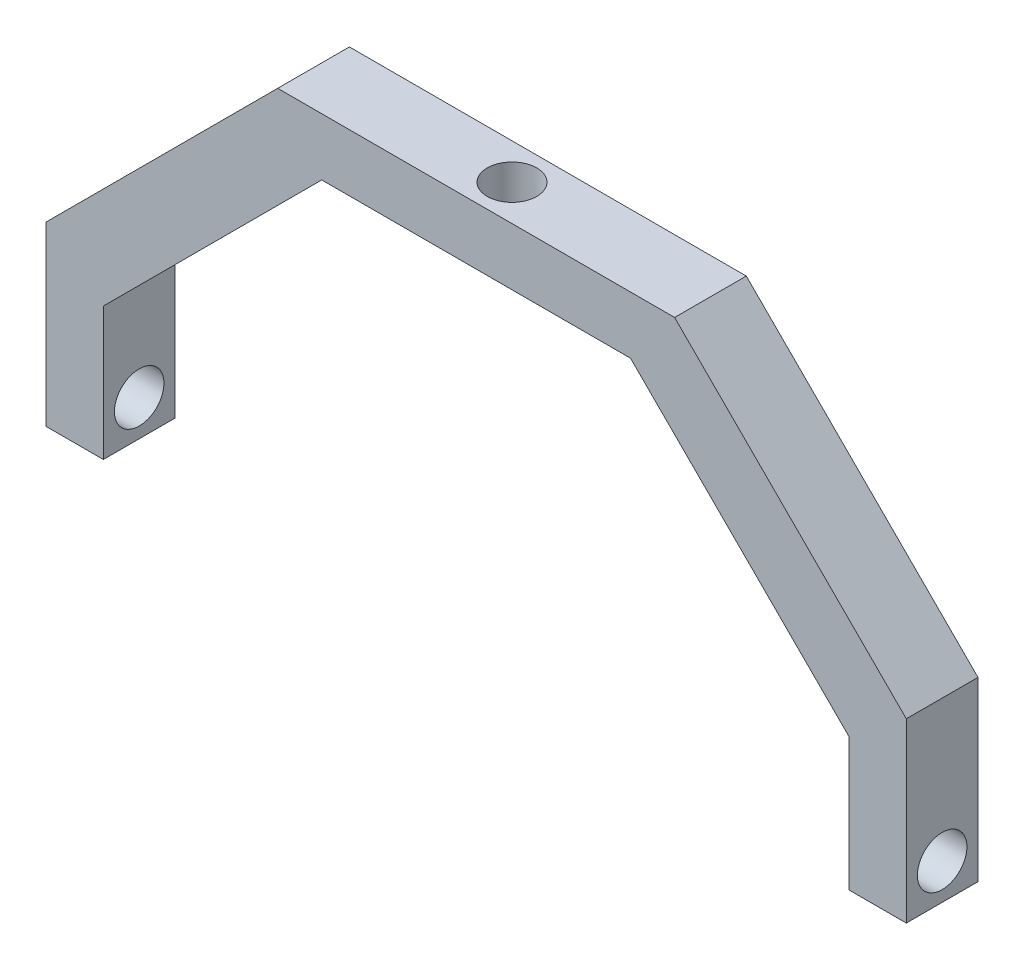
from build123d import *

# Parameters (mm, degrees)
BOSS_EXTRUDE1_DEPTH             = 5
F_29_0_136_DIAMETER_HOLE1_D     = 3.4544
F_29_0_136_DIAMETER_HOLE1_DEPTH = 4
CIRPATTERN1_START               = -30
CIRPATTERN1_OUTLINE_R           = 1.7272
CIRPATTERN1_DEPTH               = 4
CIRPATTERN1_START_2             = 22
CIRPATTERN1_2_OUTLINE_R         = 1.7272
CIRPATTERN1_2_DEPTH             = 4


# Read off the part's stored shape, not the designer's step: CirPattern1
with BuildPart() as part:
    # Sketch1 → Boss-Extrude1 (new body)
    with BuildSketch(Plane.XY):
        Polygon((-30, -2.5), (-26, -2.5), (-26, 6.769552622), (-10.769552622, 22), (10.769552622, 22), (26, 6.769552622), (26, -2.5), (30, -2.5), (30, 9.840620434), (13.840620434, 26), (-13.840620434, 26), (-30, 9.840620434), align=None)
    extrude(amount=BOSS_EXTRUDE1_DEPTH)

    # #29 (0.136) Diameter Hole1
    with Locations(Plane(origin=(30, 0, 0), x_dir=(0, 0, -1), z_dir=(1, 0, 0))):
        with Locations((-2.5, 0)):
            Hole(F_29_0_136_DIAMETER_HOLE1_D / 2, depth=F_29_0_136_DIAMETER_HOLE1_DEPTH)

    # CirPattern1 outline → CirPattern1 (cut)
    with BuildSketch(Plane.YZ.offset(CIRPATTERN1_START)):
        with Locations((0, 2.5)):
            Circle(CIRPATTERN1_OUTLINE_R)
    extrude(amount=CIRPATTERN1_DEPTH, mode=Mode.SUBTRACT)

    # CirPattern1 2 outline → CirPattern1 2 (cut)
    with BuildSketch(Plane(origin=(0, 0, 0), x_dir=(1, 0, 0), z_dir=(0, 1, 0)).offset(CIRPATTERN1_START_2)):
        with Locations((0, -2.5)):
            Circle(CIRPATTERN1_2_OUTLINE_R)
    extrude(amount=CIRPATTERN1_2_DEPTH, mode=Mode.SUBTRACT)


solid = part.part
